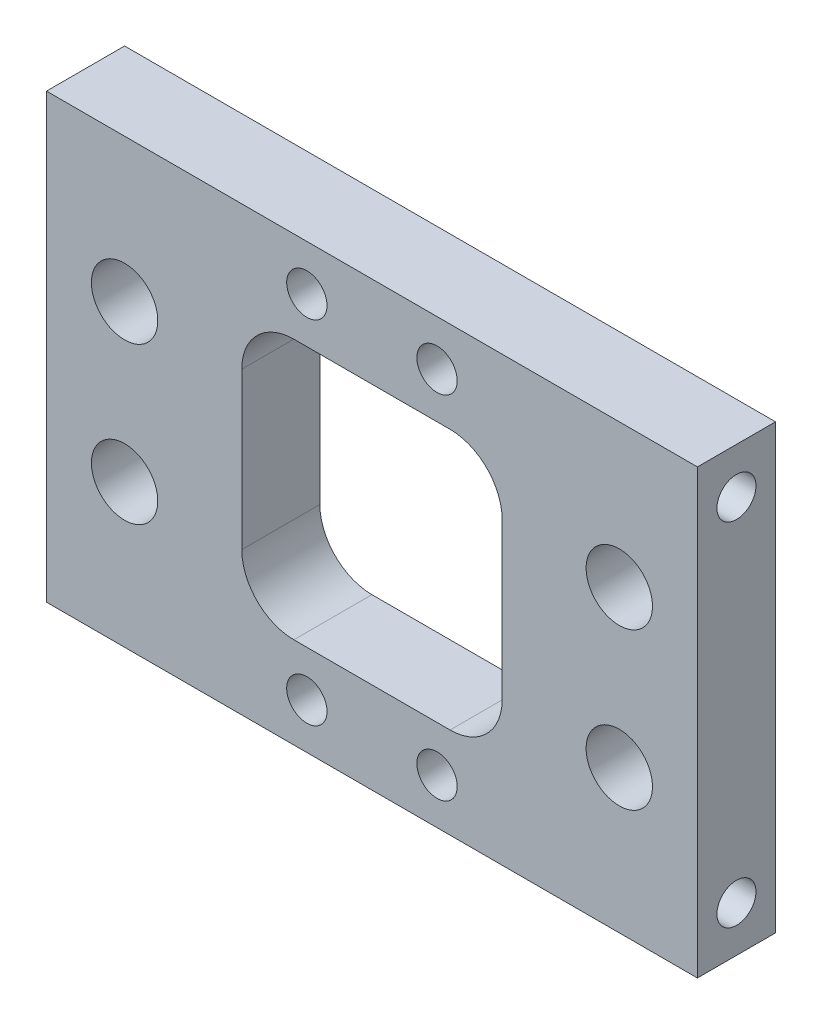
from build123d import *

# Parameters (mm, degrees)
SKETCH_1_W                = 50
SKETCH_1_H                = 34
EXTRUDE_1_DEPTH           = 6
SKETCH_2_W                = 20
SKETCH_2_H                = 20
CUT_EXTRUDE_1_DEPTH       = 31.822070015
HOLE_WIZARD_5_1_5_1_1_D   = 5.1
HOLE_WIZARD_3_0_3_1_D     = 3
HOLE_WIZARD_3_0_3_1_DEPTH = 5
HOLE_WIZARD_3_0_3_2_D     = 3
HOLE_WIZARD_3_0_3_2_DEPTH = 5
FILLET_1_R                = 4
CUT_EXTRUDE_3_REACH       = 32.822
SKETCH_9_R                = 1.55


with BuildPart() as part:
    # 草图1 → 凸台-拉伸1 (new body)
    with BuildSketch(Plane(origin=(0, 0, -3), x_dir=(-1, 0, 0), z_dir=(0, 0, -1))):
        Rectangle(SKETCH_1_W, SKETCH_1_H)
    extrude(amount=-EXTRUDE_1_DEPTH)

    # 草图2 → 切除-拉伸1 (cut, through all)
    with BuildSketch(Plane.XY.offset(3)):
        Rectangle(SKETCH_2_W, SKETCH_2_H)
    extrude(amount=-CUT_EXTRUDE_1_DEPTH, mode=Mode.SUBTRACT)

    # Ø5.1 (5.1) 直径孔1 (through all)
    with Locations(Plane(origin=(0, 0, -3), x_dir=(-1, 0, 0), z_dir=(0, 0, -1))):
        with Locations((-19, 6), (19, -6), (-19, -6), (19, 6)):
            Hole(HOLE_WIZARD_5_1_5_1_1_D / 2)

    # Ø3.0 (3) 直径孔1
    with Locations(Plane.ZY.offset(25)):
        with Locations((0, -13.5), (0, 13.5)):
            Hole(HOLE_WIZARD_3_0_3_1_D / 2, depth=HOLE_WIZARD_3_0_3_1_DEPTH)

    # Ø3.0 (3) 直径孔2
    with Locations(Plane(origin=(25, 0, 0), x_dir=(0, 0, -1), z_dir=(1, 0, 0))):
        with Locations((0, -13.5), (0, 13.5)):
            Hole(HOLE_WIZARD_3_0_3_2_D / 2, depth=HOLE_WIZARD_3_0_3_2_DEPTH)

    # 圆角1
    fillet_1_edges = [part.edges().sort_by_distance(p)[0] for p in [
        (10, -10, 0),
        (10, 10, 0),
        (-10, -10, 0),
        (-10, 10, 0),
    ]]
    fillet(fillet_1_edges, radius=FILLET_1_R)

    # 草图9 → 切除-拉伸3 (cut, up to next)
    with BuildSketch(Plane.XY.offset(3), mode=Mode.PRIVATE) as cut_extrude_3_sk1:
        with Locations((5, -13.5)):
            Circle(SKETCH_9_R)
    cut_extrude_3_tool1 = extrude(cut_extrude_3_sk1.sketch, amount=-CUT_EXTRUDE_3_REACH, mode=Mode.PRIVATE) & part.part
    # 草图9 → 切除-拉伸3 (cut, up to next)
    with BuildSketch(Plane.XY.offset(3), mode=Mode.PRIVATE) as cut_extrude_3_sk2:
        with Locations((-5, -13.5)):
            Circle(SKETCH_9_R)
    cut_extrude_3_tool2 = extrude(cut_extrude_3_sk2.sketch, amount=-CUT_EXTRUDE_3_REACH, mode=Mode.PRIVATE) & part.part
    cut_extrude_3_1 = cut_extrude_3_tool1.solids().sort_by_distance((5, -13.5, 3))[0]
    add(cut_extrude_3_1, mode=Mode.SUBTRACT)
    cut_extrude_3_2 = cut_extrude_3_tool2.solids().sort_by_distance((-5, -13.5, 3))[0]
    add(cut_extrude_3_2, mode=Mode.SUBTRACT)
    cut_extrude_3 = cut_extrude_3_1 + cut_extrude_3_2  # 切除-拉伸3 as one shape, for the pattern or mirror that repeats it

    # 镜向1: 切除-拉伸3 across plane
    add(cut_extrude_3.mirror(Plane(origin=(0, 0, 0), x_dir=(0, 0, 1), z_dir=(0, -1, 0))), mode=Mode.SUBTRACT)


solid = part.part
